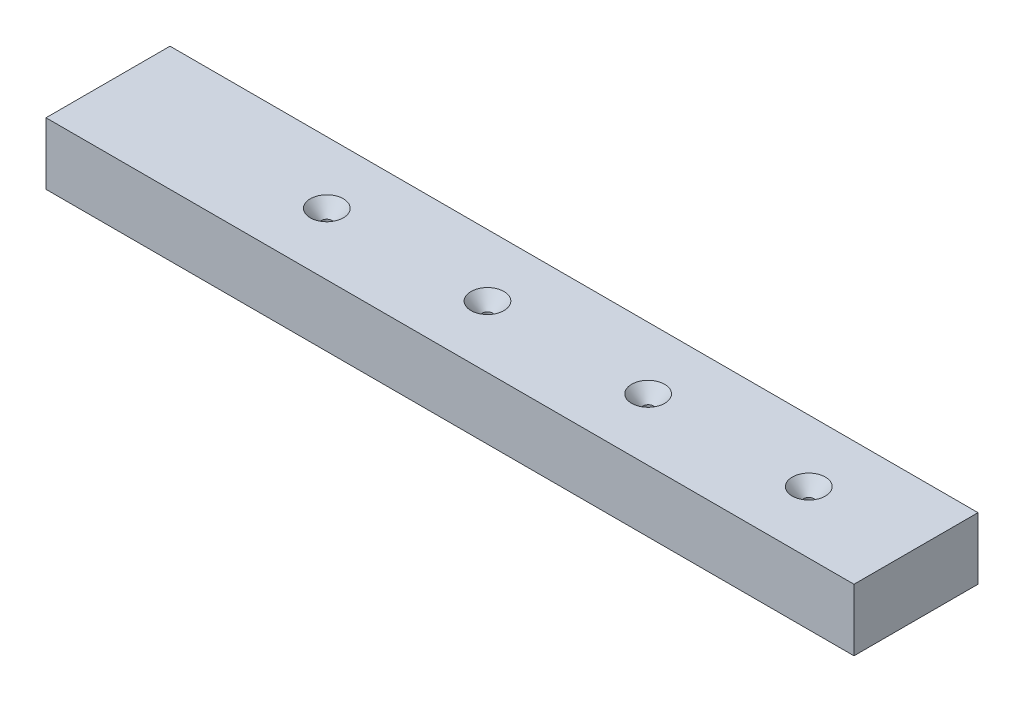
from build123d import *

# Parameters (mm, degrees)
SKETCH1_W           = 248.25
SKETCH1_H           = 19.05
BOSS_EXTRUDE1_DEPTH = 38.1
HOLE1_D             = 3.175
HOLE1_DEPTH         = 31.75
HOLE1_CSINK_D       = 10.16
HOLE1_CSINK_ANGLE   = 82
HOLE1_TIP           = 0.953866233
HOLE2_D             = 3.175
HOLE2_DEPTH         = 57.15
HOLE2_CSINK_D       = 10.16
HOLE2_CSINK_ANGLE   = 82
HOLE2_TIP           = 0.953866233


with BuildPart() as part:
    # Sketch1 → Boss-Extrude1 (new body)
    with BuildSketch(Plane.XY):
        with Locations((124.125, 47.625)):
            Rectangle(SKETCH1_W, SKETCH1_H)
    extrude(amount=BOSS_EXTRUDE1_DEPTH)

    # Hole1
    with Locations(Plane(origin=(-1073.364195846, -52.974999997, -12.7), x_dir=(0, 1, 0), z_dir=(0, 0, -1))):
        with Locations((-100.332047386, 1313.362770337), (100.599999997, 1313.362770337), (100.599999997, 1115.912770337), (100.599999997, 1214.637770337), (-100.332047386, 1214.637770337), (-100.332047386, 1115.912770337)):
            CounterSinkHole(HOLE1_D / 2, HOLE1_CSINK_D / 2, depth=HOLE1_DEPTH, counter_sink_angle=HOLE1_CSINK_ANGLE)
            with Locations((0, 0, -(HOLE1_DEPTH + HOLE1_TIP / 2))):  # 118° drill point
                Cone(0, HOLE1_D / 2, HOLE1_TIP, mode=Mode.SUBTRACT)

    # Hole2
    with Locations(Plane(origin=(-1073.364195846, 57.15, -415.792401694), x_dir=(0.3746065934159092, 0, 0.9271838545667885), z_dir=(0, 1, 0))):
        with Locations((848.944412528, 940.413642522), (885.927448463, 1031.949868564), (867.435930496, 986.181755543), (830.452894561, 894.645529501)):
            CounterSinkHole(HOLE2_D / 2, HOLE2_CSINK_D / 2, depth=HOLE2_DEPTH, counter_sink_angle=HOLE2_CSINK_ANGLE)
            with Locations((0, 0, -(HOLE2_DEPTH + HOLE2_TIP / 2))):  # 118° drill point
                Cone(0, HOLE2_D / 2, HOLE2_TIP, mode=Mode.SUBTRACT)


solid = part.part
